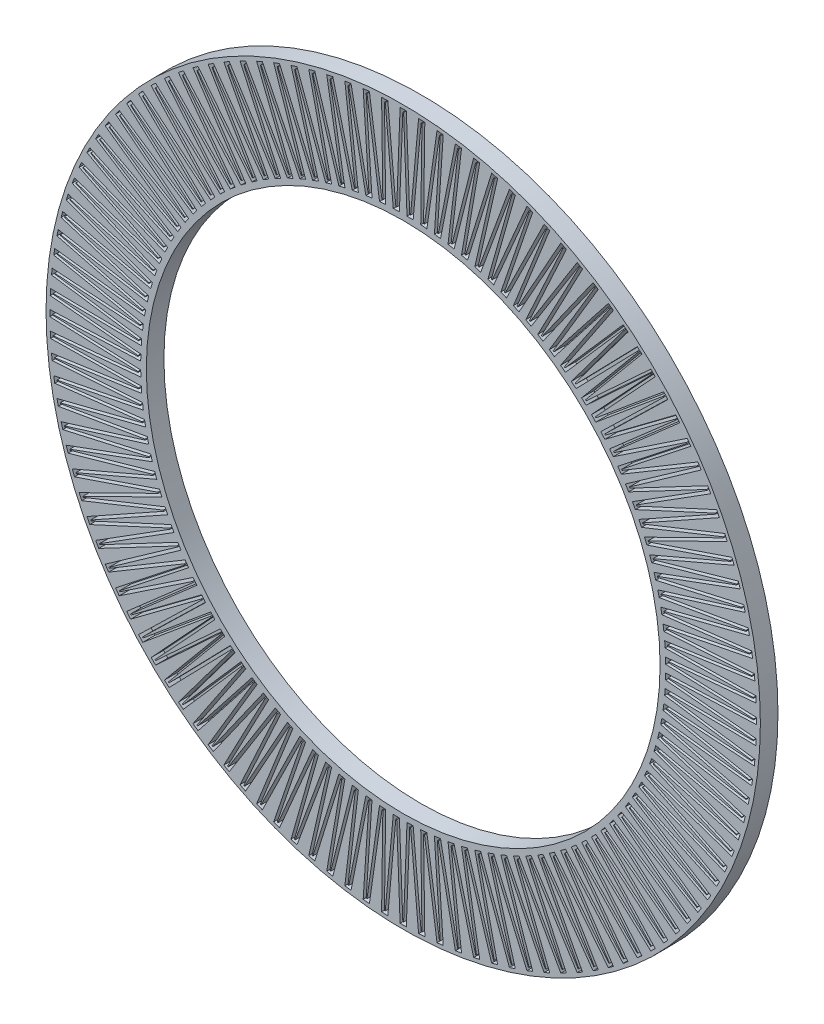
from build123d import *

# Parameters (mm, degrees)
SKETCH1_R         = 203
SKETCH1_R_2       = 146
RING_DEPTH        = 10
PLEAT_SLOTS_DEPTH = 7


with BuildPart() as part:
    # Sketch1 → Ring (new body)
    with BuildSketch(Plane.XY):
        Circle(SKETCH1_R)
        Circle(SKETCH1_R_2, mode=Mode.SUBTRACT)
    extrude(amount=RING_DEPTH)

    # Sketch2 → Pleat_slots (cut)
    with BuildSketch(Plane.XY.offset(3)):
        Polygon((200.797500005, -1.76977612), (200.797500005, 1.76977612), (150.751540076, 3.697351952), (150.738444779, 4.197441145), (200.614936936, 8.741578471), (200.429691085, 12.276279877), (150.351435879, 11.582010864), (150.312185884, 12.080729348), (199.882502269, 19.228973003), (199.512518312, 22.749135204), (149.539228848, 19.43492429), (149.473931734, 19.930905112), (198.602203556, 29.663662256), (198.048495595, 33.159636734), (148.317145185, 27.23456794), (148.225979928, 27.72645165), (196.777550009, 40.017045473), (196.041635718, 43.479250003), (146.688534536, 34.959563531), (146.571751014, 35.446001911), (194.413542875, 50.26074475), (193.497439344, 53.679689671), (144.65786081, 42.588737389), (144.515779118, 43.068397145), (191.516661733, 60.366682819), (190.422879939, 63.732997041), (142.230689943, 50.101178478), (142.063699517, 50.572744896), (188.094846734, 70.307160006), (186.826384655, 73.611616695), (139.413674641, 57.47629572), (139.22223319, 57.938476268), (184.157476834, 80.054930155), (182.717811238, 83.288472025), (136.214536148, 64.69387443), (135.999168399, 65.145402304), (179.71534409, 89.583275305), (178.108421, 92.737039443), (132.642043079, 71.734131727), (132.403339341, 72.173769321), (174.780624081, 98.866078924), (173.010847961, 101.931421081), (128.705987389, 78.577770755), (128.444601933, 79.004313053), (169.366842529, 107.877897493), (167.439064213, 110.84641578), (124.417157535, 85.206033575), (124.133806799, 85.618311454), (163.488838235, 116.594030243), (161.408341629, 119.457588157), (119.7873089, 91.60075258), (119.48276953, 91.997636014), (157.162722399, 124.990586861), (154.93521, 127.741335589), (114.829131577, 97.744400289), (114.504238294, 98.124801449), (150.405834466, 133.044552968), (148.03741173, 135.674952899), (109.556215587, 103.620137391), (109.211858899, 103.983013624), (143.236694594, 140.733853204), (140.733853204, 143.236694594), (103.983013624, 109.211858899), (103.620137391, 109.556215587), (135.674952899, 148.03741173), (133.044552968, 150.405834466), (98.124801449, 114.504238294), (97.744400289, 114.829131577), (127.741335589, 154.93521), (124.990586861, 157.162722399), (91.997636014, 119.48276953), (91.60075258, 119.7873089), (119.457588157, 161.408341629), (116.594030243, 163.488838235), (85.618311454, 124.133806799), (85.206033575, 124.417157535), (110.84641578, 167.439064213), (107.877897493, 169.366842529), (79.004313053, 128.444601933), (78.577770755, 128.705987389), (101.931421081, 173.010847961), (98.866078924, 174.780624081), (72.173769321, 132.403339341), (71.734131727, 132.642043079), (92.737039443, 178.108421), (89.583275305, 179.71534409), (65.145402304, 135.999168399), (64.69387443, 136.214536148), (83.288472025, 182.717811238), (80.054930155, 184.157476834), (57.938476268, 139.22223319), (57.47629572, 139.413674641), (73.611616695, 186.826384655), (70.307160006, 188.094846734), (50.572744896, 142.063699517), (50.101178478, 142.230689943), (63.732997041, 190.422879939), (60.366682819, 191.516661733), (43.068397145, 144.515779118), (42.588737389, 144.65786081), (53.679689671, 193.497439344), (50.26074475, 194.413542875), (35.446001911, 146.571751014), (34.959563531, 146.688534536), (43.479250003, 196.041635718), (40.017045473, 196.777550009), (27.72645165, 148.225979928), (27.23456794, 148.317145185), (33.159636734, 198.048495595), (29.663662256, 198.602203556), (19.930905112, 149.473931734), (19.43492429, 149.539228848), (22.749135204, 199.512518312), (19.228973003, 199.882502269), (12.080729348, 150.312185884), (11.582010864, 150.351435879), (12.276279877, 200.429691085), (8.741578471, 200.614936936), (4.197441145, 150.738444779), (3.697351952, 150.751540076), (1.76977612, 200.797500005), (-1.76977612, 200.797500005), (-3.697351952, 150.751540076), (-4.197441145, 150.738444779), (-8.741578471, 200.614936936), (-12.276279877, 200.429691085), (-11.582010864, 150.351435879), (-12.080729348, 150.312185884), (-19.228973003, 199.882502269), (-22.749135204, 199.512518312), (-19.43492429, 149.539228848), (-19.930905112, 149.473931734), (-29.663662256, 198.602203556), (-33.159636734, 198.048495595), (-27.23456794, 148.317145185), (-27.72645165, 148.225979928), (-40.017045473, 196.777550009), (-43.479250003, 196.041635718), (-34.959563531, 146.688534536), (-35.446001911, 146.571751014), (-50.26074475, 194.413542875), (-53.679689671, 193.497439344), (-42.588737389, 144.65786081), (-43.068397145, 144.515779118), (-60.366682819, 191.516661733), (-63.732997041, 190.422879939), (-50.101178478, 142.230689943), (-50.572744896, 142.063699517), (-70.307160006, 188.094846734), (-73.611616695, 186.826384655), (-57.47629572, 139.413674641), (-57.938476268, 139.22223319), (-80.054930155, 184.157476834), (-83.288472025, 182.717811238), (-64.69387443, 136.214536148), (-65.145402304, 135.999168399), (-89.583275305, 179.71534409), (-92.737039443, 178.108421), (-71.734131727, 132.642043079), (-72.173769321, 132.403339341), (-98.866078924, 174.780624081), (-101.931421081, 173.010847961), (-78.577770755, 128.705987389), (-79.004313053, 128.444601933), (-107.877897493, 169.366842529), (-110.84641578, 167.439064213), (-85.206033575, 124.417157535), (-85.618311454, 124.133806799), (-116.594030243, 163.488838235), (-119.457588157, 161.408341629), (-91.60075258, 119.7873089), (-91.997636014, 119.48276953), (-124.990586861, 157.162722399), (-127.741335589, 154.93521), (-97.744400289, 114.829131577), (-98.124801449, 114.504238294), (-133.044552968, 150.405834466), (-135.674952899, 148.03741173), (-103.620137391, 109.556215587), (-103.983013624, 109.211858899), (-140.733853204, 143.236694594), (-143.236694594, 140.733853204), (-109.211858899, 103.983013624), (-109.556215587, 103.620137391), (-148.03741173, 135.674952899), (-150.405834466, 133.044552968), (-114.504238294, 98.124801449), (-114.829131577, 97.744400289), (-154.93521, 127.741335589), (-157.162722399, 124.990586861), (-119.48276953, 91.997636014), (-119.7873089, 91.60075258), (-161.408341629, 119.457588157), (-163.488838235, 116.594030243), (-124.133806799, 85.618311454), (-124.417157535, 85.206033575), (-167.439064213, 110.84641578), (-169.366842529, 107.877897493), (-128.444601933, 79.004313053), (-128.705987389, 78.577770755), (-173.010847961, 101.931421081), (-174.780624081, 98.866078924), (-132.403339341, 72.173769321), (-132.642043079, 71.734131727), (-178.108421, 92.737039443), (-179.71534409, 89.583275305), (-135.999168399, 65.145402304), (-136.214536148, 64.69387443), (-182.717811238, 83.288472025), (-184.157476834, 80.054930155), (-139.22223319, 57.938476268), (-139.413674641, 57.47629572), (-186.826384655, 73.611616695), (-188.094846734, 70.307160006), (-142.063699517, 50.572744896), (-142.230689943, 50.101178478), (-190.422879939, 63.732997041), (-191.516661733, 60.366682819), (-144.515779118, 43.068397145), (-144.65786081, 42.588737389), (-193.497439344, 53.679689671), (-194.413542875, 50.26074475), (-146.571751014, 35.446001911), (-146.688534536, 34.959563531), (-196.041635718, 43.479250003), (-196.777550009, 40.017045473), (-148.225979928, 27.72645165), (-148.317145185, 27.23456794), (-198.048495595, 33.159636734), (-198.602203556, 29.663662256), (-149.473931734, 19.930905112), (-149.539228848, 19.43492429), (-199.512518312, 22.749135204), (-199.882502269, 19.228973003), (-150.312185884, 12.080729348), (-150.351435879, 11.582010864), (-200.429691085, 12.276279877), (-200.614936936, 8.741578471), (-150.738444779, 4.197441145), (-150.751540076, 3.697351952), (-200.797500005, 1.76977612), (-200.797500005, -1.76977612), (-150.751540076, -3.697351952), (-150.738444779, -4.197441145), (-200.614936936, -8.741578471), (-200.429691085, -12.276279877), (-150.351435879, -11.582010864), (-150.312185884, -12.080729348), (-199.882502269, -19.228973003), (-199.512518312, -22.749135204), (-149.539228848, -19.43492429), (-149.473931734, -19.930905112), (-198.602203556, -29.663662256), (-198.048495595, -33.159636734), (-148.317145185, -27.23456794), (-148.225979928, -27.72645165), (-196.777550009, -40.017045473), (-196.041635718, -43.479250003), (-146.688534536, -34.959563531), (-146.571751014, -35.446001911), (-194.413542875, -50.26074475), (-193.497439344, -53.679689671), (-144.65786081, -42.588737389), (-144.515779118, -43.068397145), (-191.516661733, -60.366682819), (-190.422879939, -63.732997041), (-142.230689943, -50.101178478), (-142.063699517, -50.572744896), (-188.094846734, -70.307160006), (-186.826384655, -73.611616695), (-139.413674641, -57.47629572), (-139.22223319, -57.938476268), (-184.157476834, -80.054930155), (-182.717811238, -83.288472025), (-136.214536148, -64.69387443), (-135.999168399, -65.145402304), (-179.71534409, -89.583275305), (-178.108421, -92.737039443), (-132.642043079, -71.734131727), (-132.403339341, -72.173769321), (-174.780624081, -98.866078924), (-173.010847961, -101.931421081), (-128.705987389, -78.577770755), (-128.444601933, -79.004313053), (-169.366842529, -107.877897493), (-167.439064213, -110.84641578), (-124.417157535, -85.206033575), (-124.133806799, -85.618311454), (-163.488838235, -116.594030243), (-161.408341629, -119.457588157), (-119.7873089, -91.60075258), (-119.48276953, -91.997636014), (-157.162722399, -124.990586861), (-154.93521, -127.741335589), (-114.829131577, -97.744400289), (-114.504238294, -98.124801449), (-150.405834466, -133.044552968), (-148.03741173, -135.674952899), (-109.556215587, -103.620137391), (-109.211858899, -103.983013624), (-143.236694594, -140.733853204), (-140.733853204, -143.236694594), (-103.983013624, -109.211858899), (-103.620137391, -109.556215587), (-135.674952899, -148.03741173), (-133.044552968, -150.405834466), (-98.124801449, -114.504238294), (-97.744400289, -114.829131577), (-127.741335589, -154.93521), (-124.990586861, -157.162722399), (-91.997636014, -119.48276953), (-91.60075258, -119.7873089), (-119.457588157, -161.408341629), (-116.594030243, -163.488838235), (-85.618311454, -124.133806799), (-85.206033575, -124.417157535), (-110.84641578, -167.439064213), (-107.877897493, -169.366842529), (-79.004313053, -128.444601933), (-78.577770755, -128.705987389), (-101.931421081, -173.010847961), (-98.866078924, -174.780624081), (-72.173769321, -132.403339341), (-71.734131727, -132.642043079), (-92.737039443, -178.108421), (-89.583275305, -179.71534409), (-65.145402304, -135.999168399), (-64.69387443, -136.214536148), (-83.288472025, -182.717811238), (-80.054930155, -184.157476834), (-57.938476268, -139.22223319), (-57.47629572, -139.413674641), (-73.611616695, -186.826384655), (-70.307160006, -188.094846734), (-50.572744896, -142.063699517), (-50.101178478, -142.230689943), (-63.732997041, -190.422879939), (-60.366682819, -191.516661733), (-43.068397145, -144.515779118), (-42.588737389, -144.65786081), (-53.679689671, -193.497439344), (-50.26074475, -194.413542875), (-35.446001911, -146.571751014), (-34.959563531, -146.688534536), (-43.479250003, -196.041635718), (-40.017045473, -196.777550009), (-27.72645165, -148.225979928), (-27.23456794, -148.317145185), (-33.159636734, -198.048495595), (-29.663662256, -198.602203556), (-19.930905112, -149.473931734), (-19.43492429, -149.539228848), (-22.749135204, -199.512518312), (-19.228973003, -199.882502269), (-12.080729348, -150.312185884), (-11.582010864, -150.351435879), (-12.276279877, -200.429691085), (-8.741578471, -200.614936936), (-4.197441145, -150.738444779), (-3.697351952, -150.751540076), (-1.76977612, -200.797500005), (1.76977612, -200.797500005), (3.697351952, -150.751540076), (4.197441145, -150.738444779), (8.741578471, -200.614936936), (12.276279877, -200.429691085), (11.582010864, -150.351435879), (12.080729348, -150.312185884), (19.228973003, -199.882502269), (22.749135204, -199.512518312), (19.43492429, -149.539228848), (19.930905112, -149.473931734), (29.663662256, -198.602203556), (33.159636734, -198.048495595), (27.23456794, -148.317145185), (27.72645165, -148.225979928), (40.017045473, -196.777550009), (43.479250003, -196.041635718), (34.959563531, -146.688534536), (35.446001911, -146.571751014), (50.26074475, -194.413542875), (53.679689671, -193.497439344), (42.588737389, -144.65786081), (43.068397145, -144.515779118), (60.366682819, -191.516661733), (63.732997041, -190.422879939), (50.101178478, -142.230689943), (50.572744896, -142.063699517), (70.307160006, -188.094846734), (73.611616695, -186.826384655), (57.47629572, -139.413674641), (57.938476268, -139.22223319), (80.054930155, -184.157476834), (83.288472025, -182.717811238), (64.69387443, -136.214536148), (65.145402304, -135.999168399), (89.583275305, -179.71534409), (92.737039443, -178.108421), (71.734131727, -132.642043079), (72.173769321, -132.403339341), (98.866078924, -174.780624081), (101.931421081, -173.010847961), (78.577770755, -128.705987389), (79.004313053, -128.444601933), (107.877897493, -169.366842529), (110.84641578, -167.439064213), (85.206033575, -124.417157535), (85.618311454, -124.133806799), (116.594030243, -163.488838235), (119.457588157, -161.408341629), (91.60075258, -119.7873089), (91.997636014, -119.48276953), (124.990586861, -157.162722399), (127.741335589, -154.93521), (97.744400289, -114.829131577), (98.124801449, -114.504238294), (133.044552968, -150.405834466), (135.674952899, -148.03741173), (103.620137391, -109.556215587), (103.983013624, -109.211858899), (140.733853204, -143.236694594), (143.236694594, -140.733853204), (109.211858899, -103.983013624), (109.556215587, -103.620137391), (148.03741173, -135.674952899), (150.405834466, -133.044552968), (114.504238294, -98.124801449), (114.829131577, -97.744400289), (154.93521, -127.741335589), (157.162722399, -124.990586861), (119.48276953, -91.997636014), (119.7873089, -91.60075258), (161.408341629, -119.457588157), (163.488838235, -116.594030243), (124.133806799, -85.618311454), (124.417157535, -85.206033575), (167.439064213, -110.84641578), (169.366842529, -107.877897493), (128.444601933, -79.004313053), (128.705987389, -78.577770755), (173.010847961, -101.931421081), (174.780624081, -98.866078924), (132.403339341, -72.173769321), (132.642043079, -71.734131727), (178.108421, -92.737039443), (179.71534409, -89.583275305), (135.999168399, -65.145402304), (136.214536148, -64.69387443), (182.717811238, -83.288472025), (184.157476834, -80.054930155), (139.22223319, -57.938476268), (139.413674641, -57.47629572), (186.826384655, -73.611616695), (188.094846734, -70.307160006), (142.063699517, -50.572744896), (142.230689943, -50.101178478), (190.422879939, -63.732997041), (191.516661733, -60.366682819), (144.515779118, -43.068397145), (144.65786081, -42.588737389), (193.497439344, -53.679689671), (194.413542875, -50.26074475), (146.571751014, -35.446001911), (146.688534536, -34.959563531), (196.041635718, -43.479250003), (196.777550009, -40.017045473), (148.225979928, -27.72645165), (148.317145185, -27.23456794), (198.048495595, -33.159636734), (198.602203556, -29.663662256), (149.473931734, -19.930905112), (149.539228848, -19.43492429), (199.512518312, -22.749135204), (199.882502269, -19.228973003), (150.312185884, -12.080729348), (150.351435879, -11.582010864), (200.429691085, -12.276279877), (200.614936936, -8.741578471), (150.738444779, -4.197441145), (150.751540076, -3.697351952), align=None)
        Polygon((199.197500005, -0.230215547), (199.197500005, 0.230215547), (149.191346568, 2.156258188), (149.099734847, 5.654768675), (198.936555305, 10.195291599), (198.912458204, 10.655091689), (148.874035179, 9.961374897), (148.599451116, 13.45029621), (198.130339335, 20.59285416), (198.08221118, 21.050762964), (148.148670407, 17.73918817), (147.691866619, 21.208957418), (196.781061877, 30.933973139), (196.709034585, 31.388735562), (147.017240427, 25.468379561), (146.379468982, 28.909486347), (194.892421206, 41.190304248), (194.796692199, 41.640673818), (145.48284641, 33.127763893), (144.665855394, 36.530776385), (192.469593955, 51.333735596), (192.350425619, 51.778477881), (143.549694024, 40.696347328), (142.555722753, 44.051938103), (189.519220926, 61.336464742), (189.376939893, 61.774360735), (141.223081904, 48.153384904), (140.054854784, 51.452356521), (186.049388886, 71.171074903), (185.884385138, 71.60092436), (138.509387133, 55.478437398), (137.170106194, 58.711747606), (182.069608402, 80.810610094), (181.882334205, 81.231234828), (135.41604776, 62.651427352), (133.909383877, 65.810213872), (177.590787778, 90.22864902), (177.381756435, 90.638896129), (131.951542412, 69.652694099), (130.281625247, 72.728298916), (172.625203148, 99.399377491), (172.394987601, 99.798122515), (128.125367059, 76.463047652), (126.296773738, 79.447040748), (167.186464836, 108.297659177), (166.935696089, 108.683809184), (123.94800898, 83.063821307), (121.96575155, 85.948023764), (161.289480045, 116.899104507), (161.018845438, 117.271601087), (119.430918024, 89.436922801), (117.300429716, 92.213429221), (154.950411999, 125.180137517), (154.660653323, 125.537959682), (114.586475224, 95.564883906), (112.313595557, 98.226084078), (148.186635645, 133.118060471), (147.878547108, 133.460227456), (109.427958859, 101.430908307), (107.018917639, 103.969508066), (141.016690024, 140.691116075), (140.691116075, 141.016690024), (103.969508066, 107.018917639), (101.430908307, 109.427958859), (133.460227456, 147.878547108), (133.118060471, 148.186635645), (98.226084078, 112.313595557), (95.564883906, 114.586475224), (125.537959682, 154.660653323), (125.180137517, 154.950411999), (92.213429221, 117.300429716), (89.436922801, 119.430918024), (117.271601087, 161.018845438), (116.899104507, 161.289480045), (85.948023764, 121.96575155), (83.063821307, 123.94800898), (108.683809184, 166.935696089), (108.297659177, 167.186464836), (79.447040748, 126.296773738), (76.463047652, 128.125367059), (99.798122515, 172.394987601), (99.399377491, 172.625203148), (72.728298916, 130.281625247), (69.652694099, 131.951542412), (90.638896129, 177.381756435), (90.22864902, 177.590787778), (65.810213872, 133.909383877), (62.651427352, 135.41604776), (81.231234828, 181.882334205), (80.810610094, 182.069608402), (58.711747606, 137.170106194), (55.478437398, 138.509387133), (71.60092436, 185.884385138), (71.171074903, 186.049388886), (51.452356521, 140.054854784), (48.153384904, 141.223081904), (61.774360735, 189.376939893), (61.336464742, 189.519220926), (44.051938103, 142.555722753), (40.696347328, 143.549694024), (51.778477881, 192.350425619), (51.333735596, 192.469593955), (36.530776385, 144.665855394), (33.127763893, 145.48284641), (41.640673818, 194.796692199), (41.190304248, 194.892421206), (28.909486347, 146.379468982), (25.468379561, 147.017240427), (31.388735562, 196.709034585), (30.933973139, 196.781061877), (21.208957418, 147.691866619), (17.73918817, 148.148670407), (21.050762964, 198.08221118), (20.59285416, 198.130339335), (13.45029621, 148.599451116), (9.961374897, 148.874035179), (10.655091689, 198.912458204), (10.195291599, 198.936555305), (5.654768675, 149.099734847), (2.156258188, 149.191346568), (0.230215547, 199.197500005), (-0.230215547, 199.197500005), (-2.156258188, 149.191346568), (-5.654768675, 149.099734847), (-10.195291599, 198.936555305), (-10.655091689, 198.912458204), (-9.961374897, 148.874035179), (-13.45029621, 148.599451116), (-20.59285416, 198.130339335), (-21.050762964, 198.08221118), (-17.73918817, 148.148670407), (-21.208957418, 147.691866619), (-30.933973139, 196.781061877), (-31.388735562, 196.709034585), (-25.468379561, 147.017240427), (-28.909486347, 146.379468982), (-41.190304248, 194.892421206), (-41.640673818, 194.796692199), (-33.127763893, 145.48284641), (-36.530776385, 144.665855394), (-51.333735596, 192.469593955), (-51.778477881, 192.350425619), (-40.696347328, 143.549694024), (-44.051938103, 142.555722753), (-61.336464742, 189.519220926), (-61.774360735, 189.376939893), (-48.153384904, 141.223081904), (-51.452356521, 140.054854784), (-71.171074903, 186.049388886), (-71.60092436, 185.884385138), (-55.478437398, 138.509387133), (-58.711747606, 137.170106194), (-80.810610094, 182.069608402), (-81.231234828, 181.882334205), (-62.651427352, 135.41604776), (-65.810213872, 133.909383877), (-90.22864902, 177.590787778), (-90.638896129, 177.381756435), (-69.652694099, 131.951542412), (-72.728298916, 130.281625247), (-99.399377491, 172.625203148), (-99.798122515, 172.394987601), (-76.463047652, 128.125367059), (-79.447040748, 126.296773738), (-108.297659177, 167.186464836), (-108.683809184, 166.935696089), (-83.063821307, 123.94800898), (-85.948023764, 121.96575155), (-116.899104507, 161.289480045), (-117.271601087, 161.018845438), (-89.436922801, 119.430918024), (-92.213429221, 117.300429716), (-125.180137517, 154.950411999), (-125.537959682, 154.660653323), (-95.564883906, 114.586475224), (-98.226084078, 112.313595557), (-133.118060471, 148.186635645), (-133.460227456, 147.878547108), (-101.430908307, 109.427958859), (-103.969508066, 107.018917639), (-140.691116075, 141.016690024), (-141.016690024, 140.691116075), (-107.018917639, 103.969508066), (-109.427958859, 101.430908307), (-147.878547108, 133.460227456), (-148.186635645, 133.118060471), (-112.313595557, 98.226084078), (-114.586475224, 95.564883906), (-154.660653323, 125.537959682), (-154.950411999, 125.180137517), (-117.300429716, 92.213429221), (-119.430918024, 89.436922801), (-161.018845438, 117.271601087), (-161.289480045, 116.899104507), (-121.96575155, 85.948023764), (-123.94800898, 83.063821307), (-166.935696089, 108.683809184), (-167.186464836, 108.297659177), (-126.296773738, 79.447040748), (-128.125367059, 76.463047652), (-172.394987601, 99.798122515), (-172.625203148, 99.399377491), (-130.281625247, 72.728298916), (-131.951542412, 69.652694099), (-177.381756435, 90.638896129), (-177.590787778, 90.22864902), (-133.909383877, 65.810213872), (-135.41604776, 62.651427352), (-181.882334205, 81.231234828), (-182.069608402, 80.810610094), (-137.170106194, 58.711747606), (-138.509387133, 55.478437398), (-185.884385138, 71.60092436), (-186.049388886, 71.171074903), (-140.054854784, 51.452356521), (-141.223081904, 48.153384904), (-189.376939893, 61.774360735), (-189.519220926, 61.336464742), (-142.555722753, 44.051938103), (-143.549694024, 40.696347328), (-192.350425619, 51.778477881), (-192.469593955, 51.333735596), (-144.665855394, 36.530776385), (-145.48284641, 33.127763893), (-194.796692199, 41.640673818), (-194.892421206, 41.190304248), (-146.379468982, 28.909486347), (-147.017240427, 25.468379561), (-196.709034585, 31.388735562), (-196.781061877, 30.933973139), (-147.691866619, 21.208957418), (-148.148670407, 17.73918817), (-198.08221118, 21.050762964), (-198.130339335, 20.59285416), (-148.599451116, 13.45029621), (-148.874035179, 9.961374897), (-198.912458204, 10.655091689), (-198.936555305, 10.195291599), (-149.099734847, 5.654768675), (-149.191346568, 2.156258188), (-199.197500005, 0.230215547), (-199.197500005, -0.230215547), (-149.191346568, -2.156258188), (-149.099734847, -5.654768675), (-198.936555305, -10.195291599), (-198.912458204, -10.655091689), (-148.874035179, -9.961374897), (-148.599451116, -13.45029621), (-198.130339335, -20.59285416), (-198.08221118, -21.050762964), (-148.148670407, -17.73918817), (-147.691866619, -21.208957418), (-196.781061877, -30.933973139), (-196.709034585, -31.388735562), (-147.017240427, -25.468379561), (-146.379468982, -28.909486347), (-194.892421206, -41.190304248), (-194.796692199, -41.640673818), (-145.48284641, -33.127763893), (-144.665855394, -36.530776385), (-192.469593955, -51.333735596), (-192.350425619, -51.778477881), (-143.549694024, -40.696347328), (-142.555722753, -44.051938103), (-189.519220926, -61.336464742), (-189.376939893, -61.774360735), (-141.223081904, -48.153384904), (-140.054854784, -51.452356521), (-186.049388886, -71.171074903), (-185.884385138, -71.60092436), (-138.509387133, -55.478437398), (-137.170106194, -58.711747606), (-182.069608402, -80.810610094), (-181.882334205, -81.231234828), (-135.41604776, -62.651427352), (-133.909383877, -65.810213872), (-177.590787778, -90.22864902), (-177.381756435, -90.638896129), (-131.951542412, -69.652694099), (-130.281625247, -72.728298916), (-172.625203148, -99.399377491), (-172.394987601, -99.798122515), (-128.125367059, -76.463047652), (-126.296773738, -79.447040748), (-167.186464836, -108.297659177), (-166.935696089, -108.683809184), (-123.94800898, -83.063821307), (-121.96575155, -85.948023764), (-161.289480045, -116.899104507), (-161.018845438, -117.271601087), (-119.430918024, -89.436922801), (-117.300429716, -92.213429221), (-154.950411999, -125.180137517), (-154.660653323, -125.537959682), (-114.586475224, -95.564883906), (-112.313595557, -98.226084078), (-148.186635645, -133.118060471), (-147.878547108, -133.460227456), (-109.427958859, -101.430908307), (-107.018917639, -103.969508066), (-141.016690024, -140.691116075), (-140.691116075, -141.016690024), (-103.969508066, -107.018917639), (-101.430908307, -109.427958859), (-133.460227456, -147.878547108), (-133.118060471, -148.186635645), (-98.226084078, -112.313595557), (-95.564883906, -114.586475224), (-125.537959682, -154.660653323), (-125.180137517, -154.950411999), (-92.213429221, -117.300429716), (-89.436922801, -119.430918024), (-117.271601087, -161.018845438), (-116.899104507, -161.289480045), (-85.948023764, -121.96575155), (-83.063821307, -123.94800898), (-108.683809184, -166.935696089), (-108.297659177, -167.186464836), (-79.447040748, -126.296773738), (-76.463047652, -128.125367059), (-99.798122515, -172.394987601), (-99.399377491, -172.625203148), (-72.728298916, -130.281625247), (-69.652694099, -131.951542412), (-90.638896129, -177.381756435), (-90.22864902, -177.590787778), (-65.810213872, -133.909383877), (-62.651427352, -135.41604776), (-81.231234828, -181.882334205), (-80.810610094, -182.069608402), (-58.711747606, -137.170106194), (-55.478437398, -138.509387133), (-71.60092436, -185.884385138), (-71.171074903, -186.049388886), (-51.452356521, -140.054854784), (-48.153384904, -141.223081904), (-61.774360735, -189.376939893), (-61.336464742, -189.519220926), (-44.051938103, -142.555722753), (-40.696347328, -143.549694024), (-51.778477881, -192.350425619), (-51.333735596, -192.469593955), (-36.530776385, -144.665855394), (-33.127763893, -145.48284641), (-41.640673818, -194.796692199), (-41.190304248, -194.892421206), (-28.909486347, -146.379468982), (-25.468379561, -147.017240427), (-31.388735562, -196.709034585), (-30.933973139, -196.781061877), (-21.208957418, -147.691866619), (-17.73918817, -148.148670407), (-21.050762964, -198.08221118), (-20.59285416, -198.130339335), (-13.45029621, -148.599451116), (-9.961374897, -148.874035179), (-10.655091689, -198.912458204), (-10.195291599, -198.936555305), (-5.654768675, -149.099734847), (-2.156258188, -149.191346568), (-0.230215547, -199.197500005), (0.230215547, -199.197500005), (2.156258188, -149.191346568), (5.654768675, -149.099734847), (10.195291599, -198.936555305), (10.655091689, -198.912458204), (9.961374897, -148.874035179), (13.45029621, -148.599451116), (20.59285416, -198.130339335), (21.050762964, -198.08221118), (17.73918817, -148.148670407), (21.208957418, -147.691866619), (30.933973139, -196.781061877), (31.388735562, -196.709034585), (25.468379561, -147.017240427), (28.909486347, -146.379468982), (41.190304248, -194.892421206), (41.640673818, -194.796692199), (33.127763893, -145.48284641), (36.530776385, -144.665855394), (51.333735596, -192.469593955), (51.778477881, -192.350425619), (40.696347328, -143.549694024), (44.051938103, -142.555722753), (61.336464742, -189.519220926), (61.774360735, -189.376939893), (48.153384904, -141.223081904), (51.452356521, -140.054854784), (71.171074903, -186.049388886), (71.60092436, -185.884385138), (55.478437398, -138.509387133), (58.711747606, -137.170106194), (80.810610094, -182.069608402), (81.231234828, -181.882334205), (62.651427352, -135.41604776), (65.810213872, -133.909383877), (90.22864902, -177.590787778), (90.638896129, -177.381756435), (69.652694099, -131.951542412), (72.728298916, -130.281625247), (99.399377491, -172.625203148), (99.798122515, -172.394987601), (76.463047652, -128.125367059), (79.447040748, -126.296773738), (108.297659177, -167.186464836), (108.683809184, -166.935696089), (83.063821307, -123.94800898), (85.948023764, -121.96575155), (116.899104507, -161.289480045), (117.271601087, -161.018845438), (89.436922801, -119.430918024), (92.213429221, -117.300429716), (125.180137517, -154.950411999), (125.537959682, -154.660653323), (95.564883906, -114.586475224), (98.226084078, -112.313595557), (133.118060471, -148.186635645), (133.460227456, -147.878547108), (101.430908307, -109.427958859), (103.969508066, -107.018917639), (140.691116075, -141.016690024), (141.016690024, -140.691116075), (107.018917639, -103.969508066), (109.427958859, -101.430908307), (147.878547108, -133.460227456), (148.186635645, -133.118060471), (112.313595557, -98.226084078), (114.586475224, -95.564883906), (154.660653323, -125.537959682), (154.950411999, -125.180137517), (117.300429716, -92.213429221), (119.430918024, -89.436922801), (161.018845438, -117.271601087), (161.289480045, -116.899104507), (121.96575155, -85.948023764), (123.94800898, -83.063821307), (166.935696089, -108.683809184), (167.186464836, -108.297659177), (126.296773738, -79.447040748), (128.125367059, -76.463047652), (172.394987601, -99.798122515), (172.625203148, -99.399377491), (130.281625247, -72.728298916), (131.951542412, -69.652694099), (177.381756435, -90.638896129), (177.590787778, -90.22864902), (133.909383877, -65.810213872), (135.41604776, -62.651427352), (181.882334205, -81.231234828), (182.069608402, -80.810610094), (137.170106194, -58.711747606), (138.509387133, -55.478437398), (185.884385138, -71.60092436), (186.049388886, -71.171074903), (140.054854784, -51.452356521), (141.223081904, -48.153384904), (189.376939893, -61.774360735), (189.519220926, -61.336464742), (142.555722753, -44.051938103), (143.549694024, -40.696347328), (192.350425619, -51.778477881), (192.469593955, -51.333735596), (144.665855394, -36.530776385), (145.48284641, -33.127763893), (194.796692199, -41.640673818), (194.892421206, -41.190304248), (146.379468982, -28.909486347), (147.017240427, -25.468379561), (196.709034585, -31.388735562), (196.781061877, -30.933973139), (147.691866619, -21.208957418), (148.148670407, -17.73918817), (198.08221118, -21.050762964), (198.130339335, -20.59285416), (148.599451116, -13.45029621), (148.874035179, -9.961374897), (198.912458204, -10.655091689), (198.936555305, -10.195291599), (149.099734847, -5.654768675), (149.191346568, -2.156258188), align=None, mode=Mode.SUBTRACT)
    extrude(amount=PLEAT_SLOTS_DEPTH, mode=Mode.SUBTRACT)


solid = part.part
